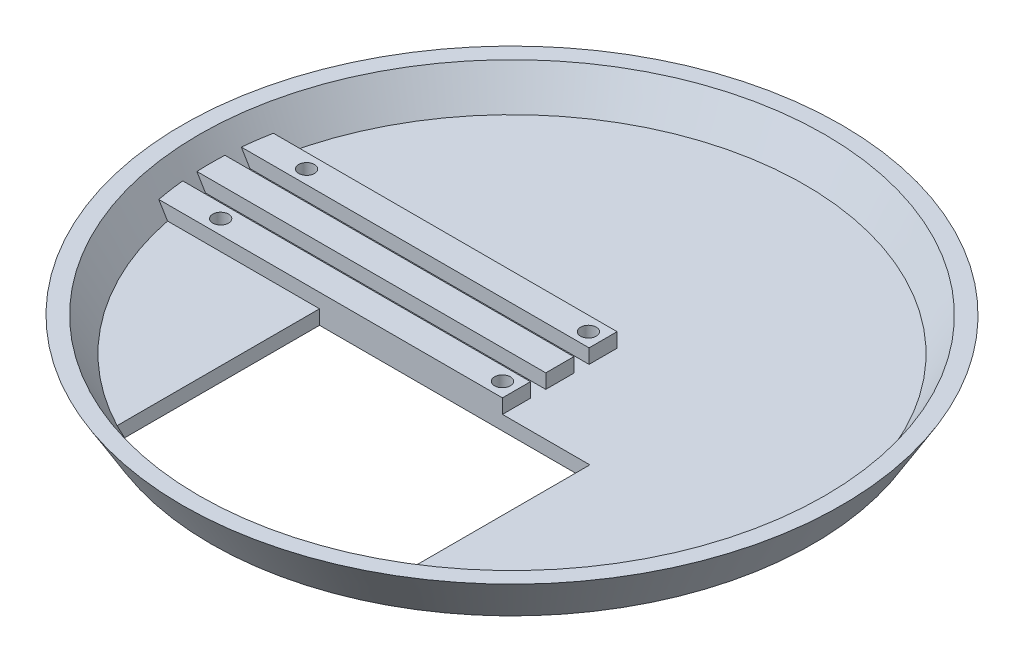
from build123d import *

# Parameters (mm, degrees)
CUT_EXTRUDE1_DEPTH       = 98.831487774
BOSS_EXTRUDE1_DEPTH      = 10
BOSS_EXTRUDE1_DEPTH_BACK = 63.5
SKETCH4_W                = 5.866666667
SKETCH4_H                = 3
SKETCH4_W_2              = 5.866666666
SKETCH5_R                = 1.65
CUT_EXTRUDE2_DEPTH       = 99.091793744


with BuildPart() as part:
    # Sketch1 → Revolve1 (revolve)
    with BuildSketch(Plane.XY):
        Polygon((0, 0), (63, 0), (69, 10), (65.501428863, 10), (61.301428863, 3), (0, 3), align=None)
    revolve(axis=Axis((0, 0, 0), (0, 1, 0)))

    # Sketch2 → Cut-Extrude1 (cut, through all)
    with BuildSketch(Plane(origin=(0, 3, 0), x_dir=(1, 0, 0), z_dir=(0, 1, 0))):
        with BuildLine():
            Line((-28.3, -12), (-28.3, -54.378076287))
            ThreePointArc((-28.3, -54.378076287), (0, -61.301428863), (28.3, -54.378076287))
            Line((28.3, -54.378076287), (28.3, -12))
            Line((28.3, -12), (-28.3, -12))
        make_face()
    extrude(amount=-CUT_EXTRUDE1_DEPTH, mode=Mode.SUBTRACT)

    # Sketch4 → Boss-Extrude1 (add, two sides: drawn at the far end of the back side and taken through both)
    with BuildSketch(Plane(origin=(0, 0, 0), x_dir=(0, 0, -1), z_dir=(1, 0, 0)).offset(-BOSS_EXTRUDE1_DEPTH_BACK)):
        with Locations((-9.066666666, 4.5)):
            Rectangle(SKETCH4_W, SKETCH4_H)
        with Locations((0, 4.5)):
            Rectangle(SKETCH4_W_2, SKETCH4_H)
        with Locations((9.066666666, 4.5)):
            Rectangle(SKETCH4_W, SKETCH4_H)
    extrude(amount=BOSS_EXTRUDE1_DEPTH + BOSS_EXTRUDE1_DEPTH_BACK)

    # Sketch5 → Cut-Extrude2 (cut, through all)
    with BuildSketch(Plane(origin=(0, 0, 0), x_dir=(1, 0, 0), z_dir=(0, 1, 0))):
        with Locations((7, -9)):
            Circle(SKETCH5_R)
        with Locations((7, 9)):
            Circle(SKETCH5_R)
        with Locations((-52, 9)):
            Circle(SKETCH5_R)
        with Locations((-52, -9)):
            Circle(SKETCH5_R)
    extrude(amount=CUT_EXTRUDE2_DEPTH, mode=Mode.SUBTRACT)


solid = part.part
